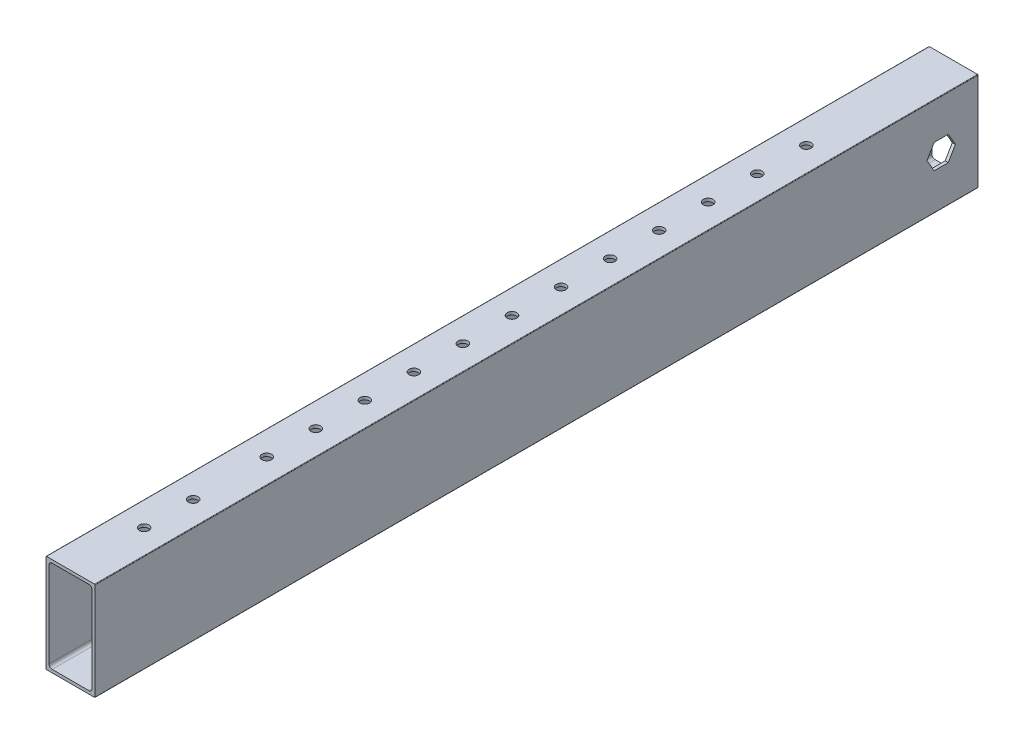
from build123d import *

# Parameters (mm, degrees)
BOSS_EXTRUDE1_DEPTH     = 457.2
CUT_EXTRUDE1_DEPTH      = 25.4
CUT_EXTRUDE2_DEPTH      = 461.188841673
CUT_EXTRUDE2_DEPTH_BACK = 461.188841673
SKETCH3_R               = 2.4892


with BuildPart() as part:
    # Sketch1 → Boss-Extrude1 (new body)
    with BuildSketch(Plane(origin=(0, 0, 0), x_dir=(-1, 0, 0), z_dir=(0, 0, -1))):
        with BuildLine():
            Line((-12.7, 25.146), (-12.7, -25.146))
            ThreePointArc((-12.7, -25.146), (-12.625605122, -25.325605122), (-12.446, -25.4))
            Line((-12.446, -25.4), (12.446, -25.4))
            ThreePointArc((12.446, -25.4), (12.625605122, -25.325605122), (12.7, -25.146))
            Line((12.7, -25.146), (12.7, 25.146))
            ThreePointArc((12.7, 25.146), (12.625605122, 25.325605122), (12.446, 25.4))
            Line((12.446, 25.4), (-12.446, 25.4))
            ThreePointArc((-12.446, 25.4), (-12.625605122, 25.325605122), (-12.7, 25.146))
        make_face()
        with BuildLine():
            Line((-11.1125, -22.225), (-11.1125, 22.225))
            ThreePointArc((-11.1125, 22.225), (-10.647532015, 23.347532015), (-9.525, 23.8125))
            Line((-9.525, 23.8125), (9.525, 23.8125))
            ThreePointArc((9.525, 23.8125), (10.647532015, 23.347532015), (11.1125, 22.225))
            Line((11.1125, 22.225), (11.1125, -22.225))
            ThreePointArc((11.1125, -22.225), (10.647532015, -23.347532015), (9.525, -23.8125))
            Line((9.525, -23.8125), (-9.525, -23.8125))
            ThreePointArc((-9.525, -23.8125), (-10.647532015, -23.347532015), (-11.1125, -22.225))
        make_face(mode=Mode.SUBTRACT)
    extrude(amount=-BOSS_EXTRUDE1_DEPTH)

    # Sketch2 → Cut-Extrude1 (cut)
    with BuildSketch(Plane.ZY.offset(12.7)):
        Polygon((26.382348419, 0), (22.716174209, 6.35), (15.383825791, 6.35), (11.717651581, 0), (15.383825791, -6.35), (22.716174209, -6.35), align=None)
    extrude(amount=-CUT_EXTRUDE1_DEPTH, mode=Mode.SUBTRACT)

    # Sketch3 → Cut-Extrude2 (cut, two sides: drawn at the far end of the back side and taken through both)
    with BuildSketch(Plane.XZ.offset(25.4).offset(-CUT_EXTRUDE2_DEPTH_BACK)):
        with Locations((0, 76.2)):
            Circle(SKETCH3_R)
        with Locations((0, 101.6)):
            Circle(SKETCH3_R)
        with Locations((0, 127)):
            Circle(SKETCH3_R)
        with Locations((0, 152.4)):
            Circle(SKETCH3_R)
        with Locations((0, 177.8)):
            Circle(SKETCH3_R)
        with Locations((0, 203.2)):
            Circle(SKETCH3_R)
        with Locations((0, 228.6)):
            Circle(SKETCH3_R)
        with Locations((0, 254)):
            Circle(SKETCH3_R)
        with Locations((0, 279.4)):
            Circle(SKETCH3_R)
        with Locations((0, 304.8)):
            Circle(SKETCH3_R)
        with Locations((0, 330.2)):
            Circle(SKETCH3_R)
        with Locations((0, 393.7)):
            Circle(SKETCH3_R)
        with Locations((0, 419.1)):
            Circle(SKETCH3_R)
        with Locations((0, 355.6)):
            Circle(SKETCH3_R)
    extrude(amount=CUT_EXTRUDE2_DEPTH + CUT_EXTRUDE2_DEPTH_BACK, mode=Mode.SUBTRACT)


solid = part.part
